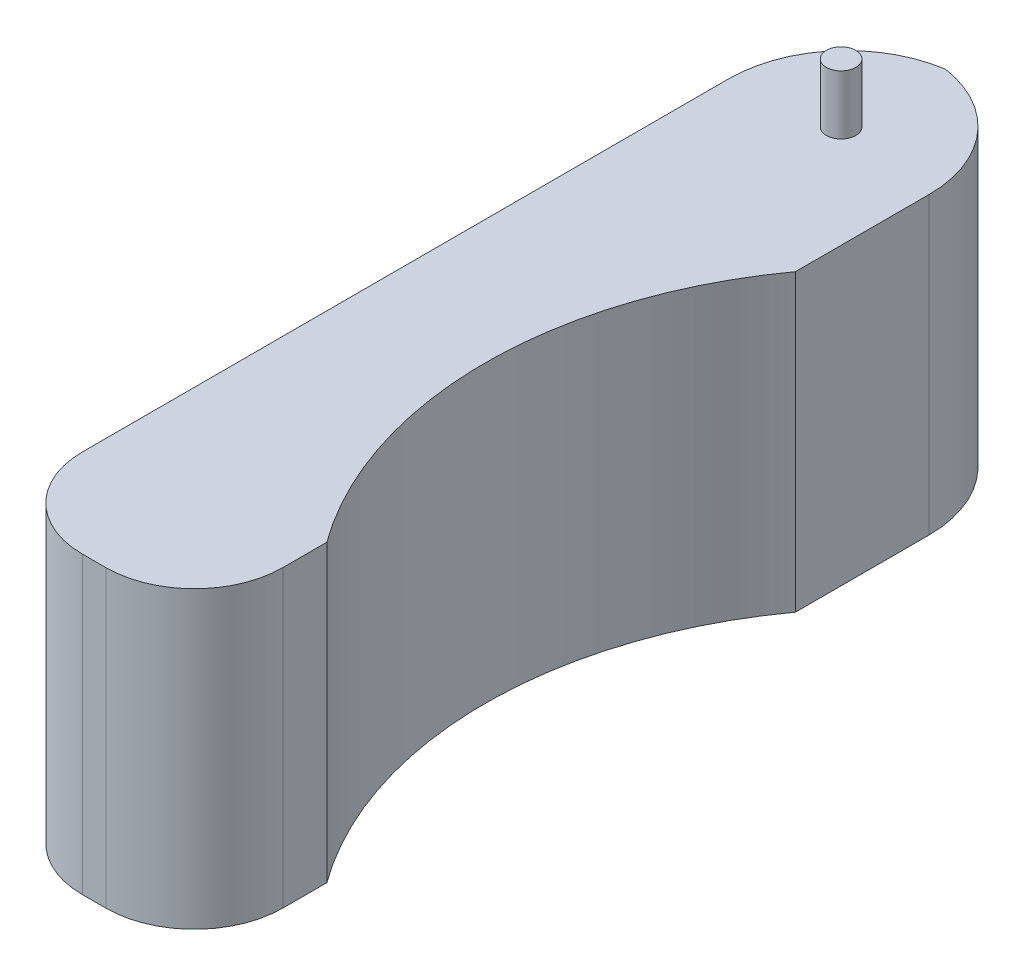
from build123d import *

# Parameters (mm, degrees)
EXTRUDE_1_DEPTH = 50
SKETCH_3_R      = 2.5
EXTRUDE_2_DEPTH = 10
FILLET_1_R      = 20


with BuildPart() as part:
    # Эскиз2 → Бобышка-Вытянуть1 (new body)
    with BuildSketch(Plane(origin=(0, 0, 0), x_dir=(1, 0, 0), z_dir=(0, 1, 0))):
        with BuildLine():
            Line((20.775320905, -61.764467554), (20.775320905, -69.224273938))
            ThreePointArc((20.775320905, -69.224273938), (16.381922622, -79.830875656), (5.775320905, -84.224273938))
            Line((5.775320905, -84.224273938), (1.80486375, -84.224273938))
            ThreePointArc((1.80486375, -84.224273938), (-8.801737968, -79.830875656), (-13.19513625, -69.224273938))
            Line((-13.19513625, -69.224273938), (-13.19513625, 60.360729655))
            Line((-13.19513625, 60.360729655), (20.775320905, 60.360729655))
            Line((20.775320905, 60.360729655), (20.775320905, 17.687097527))
            ThreePointArc((20.775320905, 17.687097527), (7.863671927, -22.038685014), (20.775320905, -61.764467554))
        make_face()
    extrude(amount=EXTRUDE_1_DEPTH)

    # Эскиз3 → Бобышка-Вытянуть2 (add)
    with BuildSketch(Plane(origin=(0, 50, 0), x_dir=(1, 0, 0), z_dir=(0, 1, 0))):
        with Locations(Location((3.403106264, 42.800743613, 0), (0, 0, 270))):
            Circle(SKETCH_3_R)
    extrude(amount=EXTRUDE_2_DEPTH)

    # Скругление1
    # the kernel refuses this fillet: 20 mm, written as the material it takes off along each edge
    with BuildSketch(Plane(origin=(-13.19513625, -50, -60.360729655), x_dir=(0, 0, 1), z_dir=(0, 1, 0))) as fillet_1_piece_1:
        with BuildLine():
            CenterArc((FILLET_1_R, FILLET_1_R), FILLET_1_R, 180, 90)
            Line((0, FILLET_1_R), (0, 0))
            Line((0, 0), (FILLET_1_R, 0))
        make_face()
    extrude(amount=150, mode=Mode.SUBTRACT)
    with BuildSketch(Plane(origin=(20.775320905, -50, -60.360729655), x_dir=(0, 0, 1), z_dir=(0, 1, 0))) as fillet_1_piece_2:
        with BuildLine():
            CenterArc((FILLET_1_R, -FILLET_1_R), FILLET_1_R, 90, 90)
            Line((0, -FILLET_1_R), (0, 0))
            Line((0, 0), (FILLET_1_R, 0))
        make_face()
    extrude(amount=150, mode=Mode.SUBTRACT)


solid = part.part
